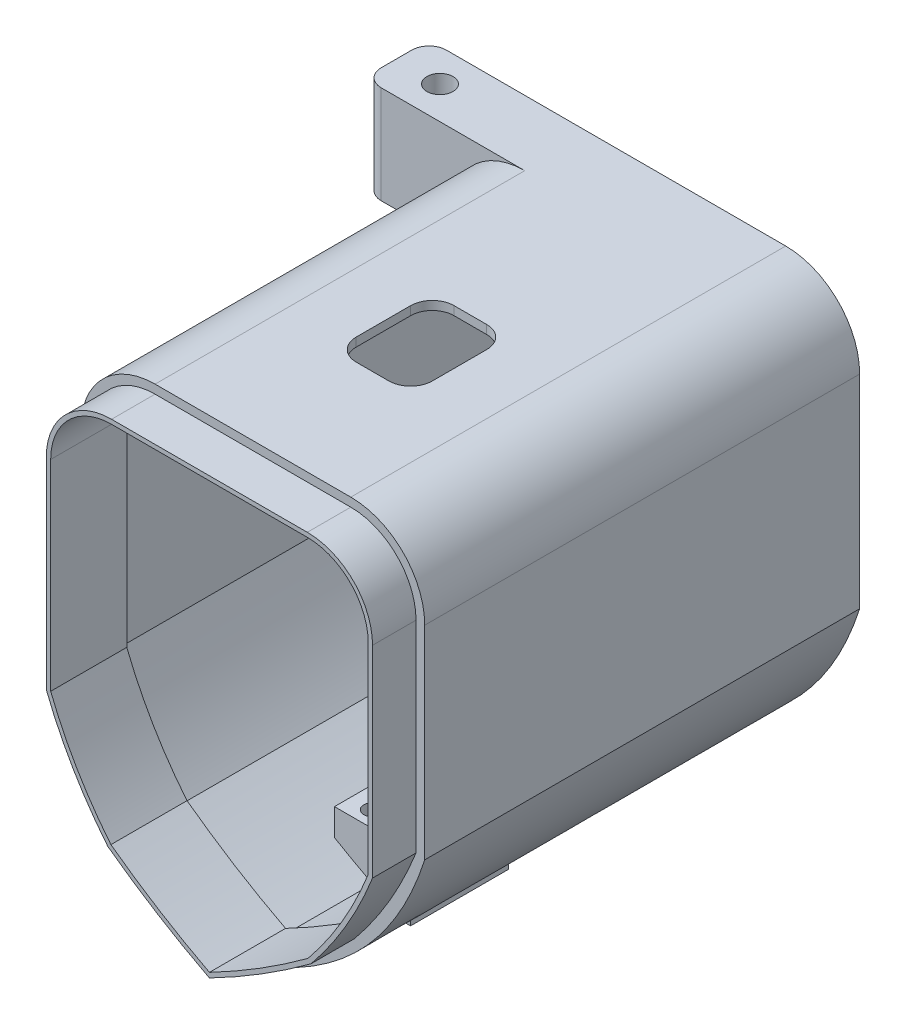
from build123d import *

# Parameters (mm, degrees)
EXTRU_MINCE2_DEPTH       = 200
EPAISSIR5_DEPTH          = 200
EPAISSIR7_DEPTH          = 200
EXTRU_MINCE3_DEPTH       = 20
EXTRU_MINCE3_DEPTH_BACK  = 15
BOSS_EXTRU_2_DEPTH       = 5
ENL_V_MAT_EXTRU_1_DEPTH  = 10
BOSS_EXTRU_3_START       = -212
ESQUISSE12_W             = 35
ESQUISSE12_H             = 45
BOSS_EXTRU_3_DEPTH       = 30
ESQUISSE13_R             = 4
ENL_V_MAT_EXTRU_2_DEPTH  = 250
BOSS_EXTRU_6_DEPTH       = 45
ESQUISSE25_R             = 6
ENL_V_MAT_EXTRU_8_DEPTH  = 45
ENL_V_MAT_EXTRU_9_DEPTH  = 45
ENL_V_MAT_EXTRU_10_DEPTH = 25


# Read off the part's stored shape, not the designer's step: Epaissir5, Epaissir7
with BuildPart() as part:
    # Esquisse3 → Extru.-Mince2 (new body)
    with BuildSketch(Plane.XY):
        with BuildLine():
            Line((-206.649507199, -11.92714811), (-206.649507199, -3.47401752))
            Line((-206.649507199, -3.47401752), (-206.649507199, 81.52598248))
            ThreePointArc((-206.649507199, 81.52598248), (-196.691137759, 105.56761304), (-172.649507199, 115.52598248))
            Line((-172.649507199, 115.52598248), (-82.649507199, 115.52598248))
            ThreePointArc((-82.649507199, 115.52598248), (-58.607876638, 105.56761304), (-48.649507199, 81.52598248))
            Line((-48.649507199, 81.52598248), (-48.649507199, -11.92714811))
            ThreePointArc((-48.649507199, -11.92714811), (-61.399009455, -38.338842544), (-78.173060849, -62.396244951))
            ThreePointArc((-78.173060849, -62.396244951), (-102.275198337, -78.711501116), (-127.649507199, -92.967905467))
            ThreePointArc((-127.649507199, -92.967905467), (-153.023816061, -78.711501116), (-177.125953549, -62.396244951))
            ThreePointArc((-177.125953549, -62.396244951), (-193.900004942, -38.338842544), (-206.649507199, -11.92714811))
        make_face()
        with BuildLine():
            Line((-202.649507199, -11.17401752), (-202.649507199, -3.47401752))
            Line((-202.649507199, -3.47401752), (-202.649507199, 81.52598248))
            ThreePointArc((-202.649507199, 81.52598248), (-193.862710634, 102.739185916), (-172.649507199, 111.52598248))
            Line((-172.649507199, 111.52598248), (-82.649507199, 111.52598248))
            ThreePointArc((-82.649507199, 111.52598248), (-61.436303763, 102.739185916), (-52.649507199, 81.52598248))
            Line((-52.649507199, 81.52598248), (-52.649507199, -11.17401752))
            ThreePointArc((-52.649507199, -11.17401752), (-64.915375774, -36.427970301), (-80.949507199, -59.47401752))
            ThreePointArc((-80.949507199, -59.47401752), (-103.722688687, -74.902894226), (-127.649507199, -88.47401752))
            ThreePointArc((-127.649507199, -88.47401752), (-151.57632571, -74.902894226), (-174.349507199, -59.47401752))
            ThreePointArc((-174.349507199, -59.47401752), (-190.383638623, -36.427970301), (-202.649507199, -11.17401752))
        make_face(mode=Mode.SUBTRACT)
    extrude(amount=EXTRU_MINCE2_DEPTH)

    # Epaissir5 outline → Epaissir5 (add)
    with BuildSketch(Plane.XY):
        with BuildLine():
            add(Edge.make_bspline(
                [(-78.173060849, -62.396244951), (-91.313583381, -75.858349648), (-107.794638855, -86.055391974), (-127.649507199, -92.967905467)],
                knots=[0.501331546, 0.501331546, 0.501331546, 0.501331546, 1, 1, 1, 1], degree=3))
            ThreePointArc((-78.173060849, -62.396244951), (-102.275198337, -78.711501116), (-127.649507199, -92.967905467))
        make_face()
        with BuildLine():
            add(Edge.make_bspline(
                [(-48.649507199, -11.92714811), (-55.127972189, -32.028220402), (-64.962362616, -48.862247174), (-78.173060849, -62.396244951)],
                knots=[0, 0, 0, 0, 0.501331546, 0.501331546, 0.501331546, 0.501331546], degree=3))
            ThreePointArc((-48.649507199, -11.92714811), (-61.399009455, -38.338842545), (-78.173060849, -62.396244951))
        make_face()
    extrude(amount=EPAISSIR5_DEPTH)

    # Epaissir7 outline → Epaissir7 (add)
    with BuildSketch(Plane.XY):
        with BuildLine():
            ThreePointArc((-177.125953549, -62.396244951), (-193.900004942, -38.338842544), (-206.649507199, -11.92714811))
            add(Edge.make_bspline(
                [(-206.649507199, -11.92714811), (-200.171042209, -32.028220402), (-190.336651781, -48.862247174), (-177.125953549, -62.396244951)],
                knots=[0, 0, 0, 0, 0.501331546, 0.501331546, 0.501331546, 0.501331546], degree=3))
        make_face()
        with BuildLine():
            ThreePointArc((-127.649507199, -92.967905467), (-153.023816061, -78.711501116), (-177.125953549, -62.396244951))
            add(Edge.make_bspline(
                [(-177.125953549, -62.396244951), (-163.985431016, -75.858349648), (-147.504375542, -86.055391974), (-127.649507199, -92.967905467)],
                knots=[0.501331546, 0.501331546, 0.501331546, 0.501331546, 1, 1, 1, 1], degree=3))
        make_face()
    extrude(amount=EPAISSIR7_DEPTH)

    # Esquisse7 → Extru.-Mince3 (add, two sides: drawn at the far end of the back side and taken through both)
    with BuildSketch(Plane.XY.offset(200).offset(-EXTRU_MINCE3_DEPTH_BACK)):
        with BuildLine():
            Line((-202.649507199, -11.17401752), (-202.649507199, -3.47401752))
            Line((-202.649507199, -3.47401752), (-202.649507199, 81.52598248))
            ThreePointArc((-202.649507199, 81.52598248), (-193.862710634, 102.739185916), (-172.649507199, 111.52598248))
            Line((-172.649507199, 111.52598248), (-82.649507199, 111.52598248))
            ThreePointArc((-82.649507199, 111.52598248), (-61.436303763, 102.739185916), (-52.649507199, 81.52598248))
            Line((-52.649507199, 81.52598248), (-52.649507199, -11.17401752))
            ThreePointArc((-52.649507199, -11.17401752), (-64.915375774, -36.427970301), (-80.949507199, -59.47401752))
            ThreePointArc((-80.949507199, -59.47401752), (-103.722688687, -74.902894226), (-127.649507199, -88.47401752))
            ThreePointArc((-127.649507199, -88.47401752), (-151.57632571, -74.902894226), (-174.349507199, -59.47401752))
            ThreePointArc((-174.349507199, -59.47401752), (-190.383638623, -36.427970301), (-202.649507199, -11.17401752))
        make_face()
        with BuildLine():
            Line((-200.649507199, -10.794210022), (-200.649507199, -3.47401752))
            Line((-200.649507199, -3.47401752), (-200.649507199, 81.52598248))
            ThreePointArc((-200.649507199, 81.52598248), (-192.448497072, 101.324972353), (-172.649507199, 109.52598248))
            Line((-172.649507199, 109.52598248), (-82.649507199, 109.52598248))
            ThreePointArc((-82.649507199, 109.52598248), (-62.850517326, 101.324972353), (-54.649507199, 81.52598248))
            Line((-54.649507199, 81.52598248), (-54.649507199, -10.794210022))
            ThreePointArc((-54.649507199, -10.794210022), (-66.673062941, -35.471620796), (-82.338728425, -58.013302636))
            ThreePointArc((-82.338728425, -58.013302636), (-104.44621972, -72.997686116), (-127.649507199, -86.221920301))
            ThreePointArc((-127.649507199, -86.221920301), (-150.852794678, -72.997686116), (-172.960285972, -58.013302636))
            ThreePointArc((-172.960285972, -58.013302636), (-188.625951457, -35.471620796), (-200.649507199, -10.794210022))
        make_face(mode=Mode.SUBTRACT)
    extrude(amount=EXTRU_MINCE3_DEPTH + EXTRU_MINCE3_DEPTH_BACK)

    # Esquisse9 → Boss.-Extru.2 (add)
    with BuildSketch(Plane(origin=(0, 0, 0), x_dir=(-1, 0, 0), z_dir=(0, 0, -1))):
        with BuildLine():
            Line((172.649507199, 111.52598248), (82.649507199, 111.52598248))
            ThreePointArc((82.649507199, 111.52598248), (61.436303763, 102.739185916), (52.649507199, 81.52598248))
            Line((52.649507199, 81.52598248), (52.649507199, -11.17401752))
            ThreePointArc((52.649507199, -11.17401752), (79.415793498, -60.238358109), (127.649507199, -88.47401752))
            ThreePointArc((127.649507199, -88.47401752), (175.815578629, -60.172728481), (202.649507199, -11.17401752))
            Line((202.649507199, -11.17401752), (202.649507199, 81.52598248))
            ThreePointArc((202.649507199, 81.52598248), (193.862710634, 102.739185916), (172.649507199, 111.52598248))
        make_face()
    extrude(amount=-BOSS_EXTRU_2_DEPTH)

    # Esquisse10 → Enlèv. mat.-Extru.1 (cut)
    with BuildSketch(Plane(origin=(0, 115.52598248, 0), x_dir=(1, 0, 0), z_dir=(0, 1, 0))):
        with BuildLine():
            Line((-127.649507199, -100), (-120.149507199, -100))
            ThreePointArc((-120.149507199, -100), (-113.078439387, -102.928932188), (-110.149507199, -110))
            Line((-110.149507199, -110), (-110.149507199, -135))
            ThreePointArc((-110.149507199, -135), (-113.078439387, -142.071067812), (-120.149507199, -145))
            Line((-120.149507199, -145), (-135.149507199, -145))
            ThreePointArc((-135.149507199, -145), (-142.220575011, -142.071067812), (-145.149507199, -135))
            Line((-145.149507199, -135), (-145.149507199, -110))
            ThreePointArc((-145.149507199, -110), (-142.220575011, -102.928932188), (-135.149507199, -100))
            Line((-135.149507199, -100), (-127.649507199, -100))
        make_face()
    extrude(amount=-ENL_V_MAT_EXTRU_1_DEPTH, mode=Mode.SUBTRACT)

    # Esquisse12 → Boss.-Extru.3 (add)
    with BuildSketch(Plane(origin=(0, 115.52598248, 0), x_dir=(1, 0, 0), z_dir=(0, 1, 0)).offset(BOSS_EXTRU_3_START)):
        with Locations((-127.649507199, -122.5)):
            Rectangle(ESQUISSE12_W, ESQUISSE12_H)
    extrude(amount=BOSS_EXTRU_3_DEPTH)

    # Esquisse13 → Enlèv. mat.-Extru.2 (cut)
    with BuildSketch(Plane(origin=(0, 115.52598248, 0), x_dir=(1, 0, 0), z_dir=(0, 1, 0))):
        with Locations(Location((-120.149507199, -107.5, 0), (0, 0, 180))):
            Circle(ESQUISSE13_R)
        with Locations(Location((-135.149507199, -107.5, 0), (0, 0, 180))):
            Circle(ESQUISSE13_R)
        with Locations(Location((-135.149507199, -137.5, 0), (0, 0, 180))):
            Circle(ESQUISSE13_R)
        with Locations(Location((-120.149507199, -137.5, 0), (0, 0, 180))):
            Circle(ESQUISSE13_R)
    extrude(amount=-ENL_V_MAT_EXTRU_2_DEPTH, mode=Mode.SUBTRACT)

    # Esquisse23 → Boss.-Extru.6 (add)
    with BuildSketch(Plane(origin=(0, 115.52598248, 0), x_dir=(1, 0, 0), z_dir=(0, 1, 0))):
        Polygon((-172.649507199, 0), (-172.649507199, -30), (-206.649507199, -30), (-246.649507199, -30), (-246.649507199, 0), align=None)
    extrude(amount=-BOSS_EXTRU_6_DEPTH)

    # Esquisse25 → Enlèv. mat.-Extru.8 (cut)
    with BuildSketch(Plane(origin=(0, 115.52598248, 0), x_dir=(1, 0, 0), z_dir=(0, 1, 0))):
        with Locations(Location((-226.649507199, -15, 0), (0, 0, 180))):
            Circle(ESQUISSE25_R)
    extrude(amount=-ENL_V_MAT_EXTRU_8_DEPTH, mode=Mode.SUBTRACT)

    # Esquisse26 → Enlèv. mat.-Extru.9 (cut)
    with BuildSketch(Plane(origin=(0, 115.52598248, 0), x_dir=(1, 0, 0), z_dir=(0, 1, 0))):
        with BuildLine():
            Line((-246.649507199, 0), (-246.649507199, -8))
            ThreePointArc((-246.649507199, -8), (-244.306361448, -2.343145751), (-238.649507199, 0))
            Line((-238.649507199, 0), (-246.649507199, 0))
        make_face()
        with BuildLine():
            ThreePointArc((-238.649507199, -30), (-244.306361448, -27.656854249), (-246.649507199, -22))
            Line((-246.649507199, -22), (-246.649507199, -30))
            Line((-246.649507199, -30), (-238.649507199, -30))
        make_face()
    extrude(amount=-ENL_V_MAT_EXTRU_9_DEPTH, mode=Mode.SUBTRACT)

    # Esquisse27 → Enlèv. mat.-Extru.10 (cut)
    with BuildSketch(Plane.XY.offset(30)):
        with BuildLine():
            Line((-172.649507199, 70.52598248), (-172.649507199, 90.52598248))
            ThreePointArc((-172.649507199, 90.52598248), (-178.507371575, 76.383846856), (-192.649507199, 70.52598248))
            Line((-192.649507199, 70.52598248), (-172.649507199, 70.52598248))
        make_face()
    extrude(amount=-ENL_V_MAT_EXTRU_10_DEPTH, mode=Mode.SUBTRACT)


solid = part.part
